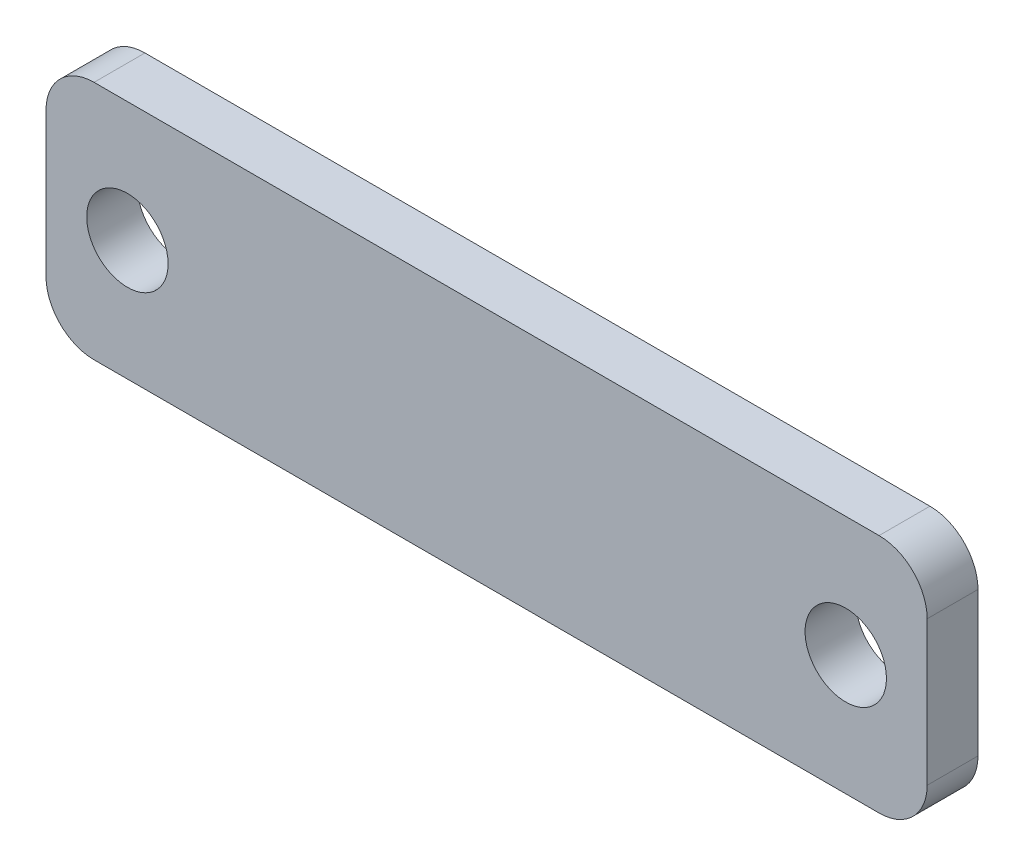
from build123d import *

# Parameters (mm, degrees)
SKETCH1_W          = 55
SKETCH1_H          = 15
BASE_FLANGE1_DEPTH = 3.175
FILLET1_R          = 3
SKETCH7_R          = 2.54
CUT_EXTRUDE1_DEPTH = 29.680666397


# Sheet-metal steps are written as plain solids
with BuildPart() as part:
    # Sketch1 → Base-Flange1 (new body)
    with BuildSketch(Plane.XY):
        Rectangle(SKETCH1_W, SKETCH1_H)
    extrude(amount=-BASE_FLANGE1_DEPTH)

    # Fillet1
    fillet1_edges = [part.edges().sort_by_distance(p)[0] for p in [
        (27.5, -7.5, -1.5875),
        (-27.5, -7.5, -1.5875),
        (-27.5, 7.5, -1.5875),
        (27.5, 7.5, -1.5875),
    ]]
    fillet(fillet1_edges, radius=FILLET1_R)

    # Sketch7 → Cut-Extrude1 (cut, through all)
    with BuildSketch(Plane.XY):
        with Locations((-22.42, 0)):
            Circle(SKETCH7_R)
        with Locations((22.42, 0)):
            Circle(SKETCH7_R)
    extrude(amount=-CUT_EXTRUDE1_DEPTH, mode=Mode.SUBTRACT)


solid = part.part
